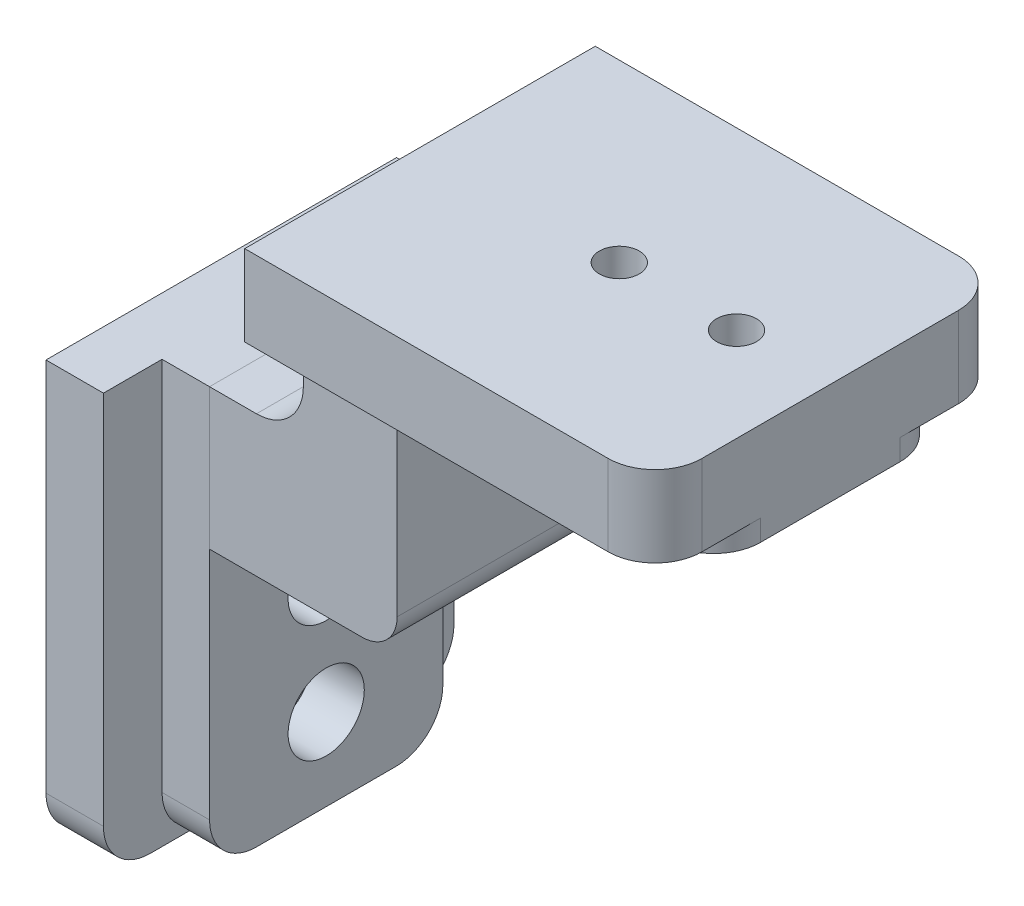
from build123d import *

# Parameters (mm, degrees)
BOSS_EXTRUDE1_DEPTH             = 10
BOSS_EXTRUDE2_DEPTH             = 6
BOSS_EXTRUDE2_DEPTH_BACK        = 30
BOSS_EXTRUDE4_START             = -35
BOSS_EXTRUDE4_DEPTH             = 35
CBORE_FOR_M3_SHCS10_D           = 3.4
CBORE_FOR_M3_SHCS10_CBORE_D     = 6.5
CBORE_FOR_M3_SHCS10_CBORE_DEPTH = 3
CBORE_FOR_M3_SHCS11_D           = 3.4
CBORE_FOR_M3_SHCS11_CBORE_D     = 6.5
CBORE_FOR_M3_SHCS11_CBORE_DEPTH = 4.5
M3X0_5_TAPPED_HOLE1_D           = 2.5
M3X0_5_TAPPED_HOLE1_DEPTH       = 13.248924226
M3X0_5_TAPPED_HOLE1_TIP         = 0.751075774
TOLERANCING_BY                  = 0.05
TOLERANCING_2_BY                = 0.05
TOLERANCING_3_BY                = 0.05
TOLERANCING_4_BY                = 0.05
TOLERANCING_5_BY                = 0.05
TOLERANCING_6_BY                = 0.05
TOLERANCING_7_BY                = 0.05
TOLERANCING_8_BY                = 0.05
TOLERANCING_9_BY                = 0.05
TOLERANCING_10_BY               = 0.05
TOLERANCING_11_BY               = 0.05
TOLERANCING_12_BY               = 0.05
FILLET2_R                       = 3
FILLET3_R                       = 4
FILLET4_R                       = 4


# Read off the part's stored shape, not the designer's step: CBORE for M3 SHCS12
with BuildPart() as part:
    # Sketch1 → Boss-Extrude1 (new, symmetric)
    with BuildSketch(Plane.XY):
        Polygon((16, -6), (0, -6), (0, 6), (8, 6), (8, 14), (16, 14), align=None)
    extrude(amount=BOSS_EXTRUDE1_DEPTH, both=True)

    # Sketch2 → Boss-Extrude2 (add, two sides: drawn at the far end of the back side and taken through both)
    with BuildSketch(Plane(origin=(0, 0, 0), x_dir=(1, 0, 0), z_dir=(0, 1, 0)).offset(-BOSS_EXTRUDE2_DEPTH_BACK)):
        Polygon((-4, 15), (-9, 15), (-9, -15), (-4, -15), (-4, -10), (0, -10), (0, 10), (-4, 10), align=None)
    extrude(amount=BOSS_EXTRUDE2_DEPTH + BOSS_EXTRUDE2_DEPTH_BACK)

    # Sketch7 → Boss-Extrude4 (add)
    with BuildSketch(Plane.ZY.offset(-8).offset(BOSS_EXTRUDE4_START)):
        Polygon((-10, 14), (-10, 15.75), (-15, 15.75), (-15, 22.75), (15, 22.75), (15, 15.75), (10, 15.75), (10, 14), align=None)
    extrude(amount=BOSS_EXTRUDE4_DEPTH)

    # CBORE for M3 SHCS10 (through all)
    with Locations(Plane(origin=(0, 14, 0), x_dir=(-1, 0, 0), z_dir=(0, -1, 0))):
        with Locations((-25, 0), (-35, 0)):
            CounterBoreHole(CBORE_FOR_M3_SHCS10_D / 2, CBORE_FOR_M3_SHCS10_CBORE_D / 2, CBORE_FOR_M3_SHCS10_CBORE_DEPTH)

    # CBORE for M3 SHCS11 (through all)
    with Locations(Plane(origin=(0, 0, 0), x_dir=(0, 0, -1), z_dir=(1, 0, 0))):
        with Locations((0, -13), (0, -23)):
            CounterBoreHole(CBORE_FOR_M3_SHCS11_D / 2, CBORE_FOR_M3_SHCS11_CBORE_D / 2, CBORE_FOR_M3_SHCS11_CBORE_DEPTH)

    # M3x0.5 Tapped Hole1
    with Locations(Plane.ZY.offset(9)):
        with Locations((-5, 0), (5, 0)):
            Hole(M3X0_5_TAPPED_HOLE1_D / 2, depth=M3X0_5_TAPPED_HOLE1_DEPTH)
            with Locations((0, 0, -(M3X0_5_TAPPED_HOLE1_DEPTH + M3X0_5_TAPPED_HOLE1_TIP / 2))):  # 118° drill point
                Cone(0, M3X0_5_TAPPED_HOLE1_D / 2, M3X0_5_TAPPED_HOLE1_TIP, mode=Mode.SUBTRACT)

    # CBORE for M3 SHCS12 outline → CBORE for M3 SHCS12 (revolve, cut)
    with BuildSketch(Plane.YX.offset(-5)):
        Polygon((1.7, 0), (1.25, 0.270387279), (1.25, -9), (3.25, -9), (3.25, -4.5), (1.7, -4.5), align=None)
    revolve(axis=Axis((0, 0, 5), (1, 0, 0)), mode=Mode.SUBTRACT)

    # CBORE for M3 SHCS12 2 outline → CBORE for M3 SHCS12 2 (revolve, cut)
    with BuildSketch(Plane.YX.offset(5)):
        Polygon((1.25, -9), (3.25, -9), (3.25, -4.5), (1.7, -4.5), (1.7, 0), (1.25, 0.270387279), align=None)
    revolve(axis=Axis((0, 0, -5), (1, 0, 0)), mode=Mode.SUBTRACT)

    # Tolerancing: a face moved inward by 0.05
    extrude(part.faces().sort_by_distance((-4, -12, 12.5))[0], amount=TOLERANCING_BY, dir=(-1, 0, 0), mode=Mode.SUBTRACT)

    # Tolerancing 2: a face moved inward by 0.05
    extrude(part.faces().sort_by_distance((16.75, 22.75, 0))[0], amount=TOLERANCING_2_BY, dir=(0, -1, 0), mode=Mode.SUBTRACT)

    # Tolerancing 3: a face moved inward by 0.05
    extrude(part.faces().sort_by_distance((25.5, 15.75, 12.5))[0], amount=TOLERANCING_3_BY, dir=(0, 1, 0), mode=Mode.SUBTRACT)

    # Tolerancing 4: a face moved inward by 0.05
    extrude(part.faces().sort_by_distance((25.5, 19.25, 15))[0], amount=TOLERANCING_4_BY, dir=(0, 0, -1), mode=Mode.SUBTRACT)

    # Tolerancing 5: a face moved inward by 0.05
    extrude(part.faces().sort_by_distance((25.5, 19.25, -15))[0], amount=TOLERANCING_5_BY, dir=(0, 0, 1), mode=Mode.SUBTRACT)

    # Tolerancing 6: a face moved inward by 0.05
    extrude(part.faces().sort_by_distance((25.5, 15.75, -12.5))[0], amount=TOLERANCING_6_BY, dir=(0, 1, 0), mode=Mode.SUBTRACT)

    # Tolerancing 7: a face moved inward by 0.05
    extrude(part.faces().sort_by_distance((7.756910569, -0.383536585, 10))[0], amount=TOLERANCING_7_BY, dir=(0, 0, -1), mode=Mode.SUBTRACT)

    # Tolerancing 8: a face moved inward by 0.05
    extrude(part.faces().sort_by_distance((-6.5, -12, 15))[0], amount=TOLERANCING_8_BY, dir=(0, 0, -1), mode=Mode.SUBTRACT)

    # Tolerancing 9: a face moved inward by 0.05
    extrude(part.faces().sort_by_distance((-9, -3, 0))[0], amount=TOLERANCING_9_BY, dir=(1, 0, 0), mode=Mode.SUBTRACT)

    # Tolerancing 10: a face moved inward by 0.05
    extrude(part.faces().sort_by_distance((-6.5, -12, -15))[0], amount=TOLERANCING_10_BY, dir=(0, 0, 1), mode=Mode.SUBTRACT)

    # Tolerancing 11: a face moved inward by 0.05
    extrude(part.faces().sort_by_distance((-4, -12, -12.5))[0], amount=TOLERANCING_11_BY, dir=(-1, 0, 0), mode=Mode.SUBTRACT)

    # Tolerancing 12: a face moved inward by 0.05
    extrude(part.faces().sort_by_distance((7.756910569, -0.383536585, -10))[0], amount=TOLERANCING_12_BY, dir=(0, 0, 1), mode=Mode.SUBTRACT)

    # Fillet2
    fillet2_edges = [part.edges().sort_by_distance(p)[0] for p in [
        (16, -6, 0),
        (16, 14, 0),
    ]]
    fillet(fillet2_edges, radius=FILLET2_R)

    # Fillet3
    fillet3_edges = [part.edges().sort_by_distance(p)[0] for p in [
        (8, 6, 0),
    ]]
    fillet(fillet3_edges, radius=FILLET3_R)

    # Fillet4
    fillet4_edges = [part.edges().sort_by_distance(p)[0] for p in [
        (-2.025, -30, -9.95),
        (-2.025, -30, 9.95),
        (-6.5, -30, 14.95),
        (-6.5, -30, -14.95),
        (43, 14.9, -9.95),
        (43, 19.25, -14.95),
        (43, 19.25, 14.95),
        (43, 14.9, 9.95),
    ]]
    fillet(fillet4_edges, radius=FILLET4_R)


with BuildPart() as body_2:
    # Split1: the piece on the far side of the plane
    add(part.part)
    split(bisect_by=Plane(origin=(0, 0, 0), x_dir=(0, 0, 1), z_dir=(1, 0, 0)), keep=Keep.BOTTOM)


with BuildPart() as part_1:
    add(part.part)

    # Split1
    split(bisect_by=Plane(origin=(0, 0, 0), x_dir=(0, 0, 1), z_dir=(1, 0, 0)), keep=Keep.TOP)


solid = Compound([body_2.part, part_1.part])
